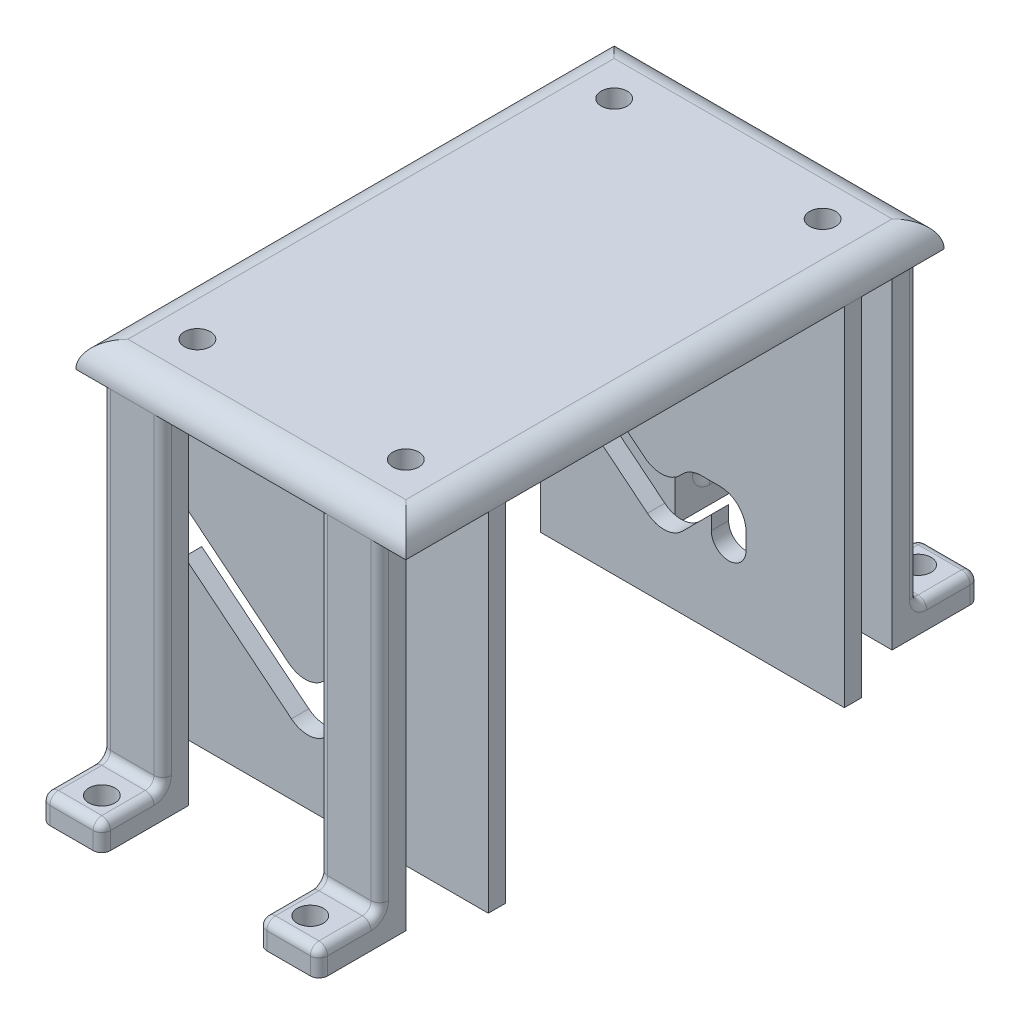
from build123d import *

# Parameters (mm, degrees)
CROQUIS1_W               = 38
CROQUIS1_H               = 62
SALIENTE_EXTRUIR1_DEPTH  = 3
CROQUIS2_R               = 1.5
CORTAR_EXTRUIR1_DEPTH    = 73.780491892
SALIENTE_EXTRUIR2_DEPTH  = 40
REDONDEO2_DEPTH          = 38
REDONDEO2_START          = -1
REDONDEO2_2_DEPTH        = 64
CROQUIS8_W               = 7
CROQUIS8_H               = 7
SALIENTE_EXTRUIR6_DEPTH  = 3
CROQUIS12_R              = 1.5
CROQUIS12_W              = 3
CROQUIS12_H              = 6
CORTAR_EXTRUIR6_DEPTH    = 40
CROQUIS14_W              = 18
CROQUIS14_H              = 20
SALIENTE_EXTRUIR7_DEPTH  = 3
CROQUIS15_W              = 18
CROQUIS15_H              = 20
SALIENTE_EXTRUIR8_DEPTH  = 3
CROQUIS17_W              = 38
CROQUIS17_H              = 2
SALIENTE_EXTRUIR9_DEPTH  = 40
CORTAR_EXTRUIR7_DEPTH    = 89.345911054
REDONDEO3_R              = 3
CROQUIS18_W              = 3
CROQUIS18_H              = 2
CORTAR_EXTRUIR8_DEPTH    = 40
CROQUIS19_W              = 18
CROQUIS19_H              = 20
CORTAR_EXTRUIR9_DEPTH    = 3
CROQUIS20_W              = 18
CROQUIS20_H              = 20
CORTAR_EXTRUIR10_DEPTH   = 3
SALIENTE_EXTRUIR10_DEPTH = 3
SALIENTE_EXTRUIR11_DEPTH = 3
REDONDEO4_R              = 1


with BuildPart() as part:
    # Croquis1 → Saliente-Extruir1 (new body)
    with BuildSketch(Plane(origin=(0, 0, 0), x_dir=(1, 0, 0), z_dir=(0, 1, 0))):
        with Locations((19, -31)):
            Rectangle(CROQUIS1_W, CROQUIS1_H)
    extrude(amount=SALIENTE_EXTRUIR1_DEPTH)

    # Croquis2 → Cortar-Extruir1 (cut, through all)
    with BuildSketch(Plane(origin=(0, 3, 0), x_dir=(1, 0, 0), z_dir=(0, 1, 0))):
        with Locations(Location((7, -7, 0), (0, 0, 270))):
            Circle(CROQUIS2_R)
        with Locations(Location((31, -7, 0), (0, 0, 270))):
            Circle(CROQUIS2_R)
        with Locations(Location((7, -55, 0), (0, 0, 270))):
            Circle(CROQUIS2_R)
        with Locations(Location((31, -55, 0), (0, 0, 270))):
            Circle(CROQUIS2_R)
    extrude(amount=-CORTAR_EXTRUIR1_DEPTH, mode=Mode.SUBTRACT)

    # Croquis3 → Saliente-Extruir2 (add)
    with BuildSketch(Plane.XZ):
        Polygon((38, 62), (38, 56), (35, 56), (35, 59), (28, 59), (28, 62), align=None)
        Polygon((0, 62), (10, 62), (10, 59), (3, 59), (3, 56), (0, 56), align=None)
        Polygon((0, 6), (0, 0), (10, 0), (10, 3), (3, 3), (3, 6), align=None)
        Polygon((28, 0), (38, 0), (38, 6), (35, 6), (35, 3), (28, 3), align=None)
    extrude(amount=SALIENTE_EXTRUIR2_DEPTH)

    # Redondeo2: read off the stored shape, not the designer's step
    # Redondeo2 outline → Redondeo2 (cut)
    with BuildSketch(Plane.YZ):
        with BuildLine():
            ThreePointArc((0, 62), (2.121320344, 61.121320344), (3, 59))
            Line((3, 59), (3, 62))
            Line((3, 62), (0, 62))
        make_face()
        with BuildLine():
            ThreePointArc((3, 3), (2.121320344, 0.878679656), (0, 0))
            Line((0, 0), (3, 0))
            Line((3, 0), (3, 3))
        make_face()
    extrude(amount=REDONDEO2_DEPTH, mode=Mode.SUBTRACT)

    # Redondeo2 2 outline → Redondeo2 2 (cut)
    with BuildSketch(Plane.XY.offset(REDONDEO2_START)):
        with BuildLine():
            Line((0, 3), (0, 0))
            ThreePointArc((0, 0), (0.878679656, 2.121320344), (3, 3))
            Line((3, 3), (0, 3))
        make_face()
        with BuildLine():
            Line((38, 3), (35, 3))
            ThreePointArc((35, 3), (37.121320344, 2.121320344), (38, 0))
            Line((38, 0), (38, 3))
        make_face()
    extrude(amount=REDONDEO2_2_DEPTH, mode=Mode.SUBTRACT)

    # Croquis8 → Saliente-Extruir6 (add)
    with BuildSketch(Plane.XZ.offset(40)):
        with Locations((6.5, 65.5)):
            Rectangle(CROQUIS8_W, CROQUIS8_H)
        with Locations((31.5, 65.5)):
            Rectangle(CROQUIS8_W, CROQUIS8_H)
        with Locations((31.5, -3.5)):
            Rectangle(CROQUIS8_W, CROQUIS8_H)
        with Locations((6.5, -3.5)):
            Rectangle(CROQUIS8_W, CROQUIS8_H)
    extrude(amount=-SALIENTE_EXTRUIR6_DEPTH)

    # Croquis12 → Cortar-Extruir6 (cut)
    with BuildSketch(Plane.XZ.offset(40)):
        with Locations(Location((7, -4, 0), (0, 0, 270))):
            Circle(CROQUIS12_R)
        with Locations(Location((31, -4, 0), (0, 0, 270))):
            Circle(CROQUIS12_R)
        with Locations(Location((31, 66, 0), (0, 0, 270))):
            Circle(CROQUIS12_R)
        with Locations(Location((7, 66, 0), (0, 0, 270))):
            Circle(CROQUIS12_R)
        with Locations((36.5, 3)):
            Rectangle(CROQUIS12_W, CROQUIS12_H)
        with Locations((36.5, 59)):
            Rectangle(CROQUIS12_W, CROQUIS12_H)
        with Locations((1.5, 59)):
            Rectangle(CROQUIS12_W, CROQUIS12_H)
        with Locations((1.5, 3)):
            Rectangle(CROQUIS12_W, CROQUIS12_H)
    extrude(amount=-CORTAR_EXTRUIR6_DEPTH, mode=Mode.SUBTRACT)

    # Croquis14 → Saliente-Extruir7 (add)
    with BuildSketch(Plane(origin=(0, 0, 59), x_dir=(-1, 0, 0), z_dir=(0, 0, -1))):
        with Locations((-19, -30)):
            Rectangle(CROQUIS14_W, CROQUIS14_H)
    extrude(amount=-SALIENTE_EXTRUIR7_DEPTH)

    # Croquis15 → Saliente-Extruir8 (add)
    with BuildSketch(Plane.XY.offset(3)):
        with Locations((19, -30)):
            Rectangle(CROQUIS15_W, CROQUIS15_H)
    extrude(amount=-SALIENTE_EXTRUIR8_DEPTH)

    # Croquis17 → Saliente-Extruir9 (add)
    with BuildSketch(Plane.XZ):
        with Locations((19, 10.5)):
            Rectangle(CROQUIS17_W, CROQUIS17_H)
        with Locations((19, 51.5)):
            Rectangle(CROQUIS17_W, CROQUIS17_H)
    extrude(amount=SALIENTE_EXTRUIR9_DEPTH)

    # Croquis16 → Cortar-Extruir7 (cut, through all)
    with BuildSketch(Plane(origin=(0, 0, 0), x_dir=(-1, 0, 0), z_dir=(0, 0, -1))):
        with BuildLine():
            Line((-17.42778873, -33.646749521), (-3, -21.929542881))
            Line((-3, -21.929542881), (-3, -16.776599839))
            Line((-3, -16.776599839), (-17.113112675, -28.238249343))
            Line((-17.113112675, -28.238249343), (-20.299570201, -25.079703159))
            Line((-20.299570201, -25.079703159), (-26.67778873, -25.079703159))
            Line((-26.67778873, -25.079703159), (-26.67778873, -30))
            ThreePointArc((-26.67778873, -30), (-24.67778873, -32), (-22.67778873, -30))
            Line((-22.67778873, -30), (-22.67778873, -28.396749521))
            Line((-22.67778873, -28.396749521), (-17.42778873, -33.646749521))
        make_face()
    extrude(amount=-CORTAR_EXTRUIR7_DEPTH, mode=Mode.SUBTRACT)

    # Redondeo3
    redondeo3_edges = [part.edges().sort_by_distance(p)[0] for p in [
        (26.67778873, -25.079703159, 60.5),
        (26.67778873, -25.079703159, 1.5),
        (26.67778873, -25.079703159, 10.5),
        (26.67778873, -25.079703159, 51.5),
        (20.299570201, -25.079703159, 60.5),
        (20.299570201, -25.079703159, 1.5),
        (20.299570201, -25.079703159, 10.5),
        (20.299570201, -25.079703159, 51.5),
        (17.113112675, -28.238249343, 60.5),
        (17.113112675, -28.238249343, 1.5),
        (17.113112675, -28.238249343, 10.5),
        (17.113112675, -28.238249343, 51.5),
        (17.42778873, -33.646749521, 60.5),
        (17.42778873, -33.646749521, 1.5),
        (17.42778873, -33.646749521, 10.5),
        (17.42778873, -33.646749521, 51.5),
    ]]
    fillet(redondeo3_edges, radius=REDONDEO3_R)

    # Croquis18 → Cortar-Extruir8 (cut)
    with BuildSketch(Plane.XZ.offset(40)):
        with Locations((1.5, 51.5)):
            Rectangle(CROQUIS18_W, CROQUIS18_H)
        with Locations((1.5, 10.5)):
            Rectangle(CROQUIS18_W, CROQUIS18_H)
    extrude(amount=-CORTAR_EXTRUIR8_DEPTH, mode=Mode.SUBTRACT)

    # Croquis19 → Cortar-Extruir9 (cut)
    with BuildSketch(Plane(origin=(0, 0, 0), x_dir=(-1, 0, 0), z_dir=(0, 0, -1))):
        with Locations((-19, -30)):
            Rectangle(CROQUIS19_W, CROQUIS19_H)
    extrude(amount=-CORTAR_EXTRUIR9_DEPTH, mode=Mode.SUBTRACT)


with BuildPart() as cortar_extruir9_piece_1:
    # of the separate pieces the step leaves, piece 1, a body of its own (cortar_extruir9_pieces)
    add(part.part.solids().sort_by_distance((3, -16.776599839, 0))[0])

    # Croquis20 → Cortar-Extruir10 (cut)
    with BuildSketch(Plane.XY.offset(62)):
        with Locations((19, -30)):
            Rectangle(CROQUIS20_W, CROQUIS20_H)
    extrude(amount=-CORTAR_EXTRUIR10_DEPTH, mode=Mode.SUBTRACT)


with BuildPart() as cortar_extruir9_piece_2:
    # of the separate pieces the step leaves, piece 2, a body of its own (cortar_extruir9_pieces)
    add(part.part.solids().sort_by_distance((10, -27.614436666, 0))[0])



with BuildPart() as cortar_extruir10_piece_1:
    # of the separate pieces the step leaves, piece 1, a body of its own (cortar_extruir10_pieces)
    add(cortar_extruir9_piece_1.part.solids().sort_by_distance((3, -16.776599839, 0))[0])



with BuildPart() as cortar_extruir10_piece_2:
    # of the separate pieces the step leaves, piece 2, a body of its own (cortar_extruir10_pieces)
    add(cortar_extruir9_piece_1.part.solids().sort_by_distance((10, -27.614436666, 59))[0])


with BuildPart() as cortar_extruir10_piece_1_1:
    add(cortar_extruir10_piece_1.part)

    add(cortar_extruir10_piece_2.part)  # Saliente-Extruir10 merges Cortar-Extruir10 piece 2
    # Croquis21 → Saliente-Extruir10 (add)
    with BuildSketch(Plane.XY.offset(62)):
        Polygon((3, -16.776599839), (3, -21.929542881), (10, -27.614436666), (10, -22.461493624), align=None)
    extrude(amount=-SALIENTE_EXTRUIR10_DEPTH)


with BuildPart() as cortar_extruir9_piece_2_1:
    add(cortar_extruir9_piece_2.part)

    add(cortar_extruir10_piece_1_1.part)  # Saliente-Extruir11 merges Cortar-Extruir10 piece 1
    # Croquis22 → Saliente-Extruir11 (add)
    with BuildSketch(Plane(origin=(0, 0, 0), x_dir=(-1, 0, 0), z_dir=(0, 0, -1))):
        Polygon((-10, -22.461493624), (-3, -16.776599839), (-3, -21.929542881), (-10, -27.614436666), align=None)
    extrude(amount=-SALIENTE_EXTRUIR11_DEPTH)

    # Redondeo4
    # the kernel refuses this fillet: 1 mm, written as the material it adds along each edge
    with BuildSketch(Plane(origin=(10, -37, 0), x_dir=(0, 1, 0), z_dir=(-1, 0, 0)), Plane(origin=(28, -37, 62), x_dir=(0, 1, 0), z_dir=(1, 0, 0))) as redondeo4_piece_1:
        with BuildLine():
            CenterArc((REDONDEO4_R, REDONDEO4_R), REDONDEO4_R, 180, 90)
            Line((0, REDONDEO4_R), (0, 0))
            Line((0, 0), (REDONDEO4_R, 0))
        make_face()
    extrude(amount=7)
    with BuildSketch(Plane(origin=(28, -37, 0), x_dir=(0, 1, 0), z_dir=(1, 0, 0)), Plane(origin=(10, -37, 62), x_dir=(0, 1, 0), z_dir=(-1, 0, 0))) as redondeo4_piece_2:
        with BuildLine():
            CenterArc((REDONDEO4_R, -REDONDEO4_R), REDONDEO4_R, 90, 90)
            Line((0, -REDONDEO4_R), (0, 0))
            Line((0, 0), (REDONDEO4_R, 0))
        make_face()
    extrude(amount=7)
    # the kernel refuses this fillet: 1 mm, written as the material it takes off along each edge
    with BuildSketch(Plane(origin=(0.5, -37, -7), x_dir=(0, -1, 0), z_dir=(1, 0, 0)), Plane(origin=(37.5, -37, 69), x_dir=(0, -1, 0), z_dir=(-1, 0, 0))) as redondeo4_2_piece_1:
        with BuildLine():
            CenterArc((REDONDEO4_R, -REDONDEO4_R), REDONDEO4_R, 90, 90)
            Line((0, -REDONDEO4_R), (0, 0))
            Line((0, 0), (REDONDEO4_R, 0))
        make_face()
    extrude(amount=12, mode=Mode.SUBTRACT)
    with BuildSketch(Plane(origin=(10, -42.5, -7), x_dir=(0, 0, 1), z_dir=(0, 1, 0)), Plane(origin=(28, -42.5, 69), x_dir=(0, 0, -1), z_dir=(0, 1, 0)), Plane(origin=(35, -42.5, -7), x_dir=(0, 0, 1), z_dir=(0, 1, 0)), Plane(origin=(3, -42.5, 69), x_dir=(0, 0, -1), z_dir=(0, 1, 0))) as redondeo4_2_piece_2:
        with BuildLine():
            CenterArc((REDONDEO4_R, -REDONDEO4_R), REDONDEO4_R, 90, 90)
            Line((0, -REDONDEO4_R), (0, 0))
            Line((0, 0), (REDONDEO4_R, 0))
        make_face()
    extrude(amount=8, mode=Mode.SUBTRACT)
    with BuildSketch(Plane(origin=(3, -42.5, -7), x_dir=(0, 0, 1), z_dir=(0, 1, 0)), Plane(origin=(28, -42.5, -7), x_dir=(0, 0, 1), z_dir=(0, 1, 0)), Plane(origin=(10, -42.5, 69), x_dir=(0, 0, -1), z_dir=(0, 1, 0)), Plane(origin=(35, -42.5, 69), x_dir=(0, 0, -1), z_dir=(0, 1, 0))) as redondeo4_2_piece_3:
        with BuildLine():
            CenterArc((REDONDEO4_R, REDONDEO4_R), REDONDEO4_R, 180, 90)
            Line((0, REDONDEO4_R), (0, 0))
            Line((0, 0), (REDONDEO4_R, 0))
        make_face()
    extrude(amount=8, mode=Mode.SUBTRACT)
    with BuildSketch(Plane(origin=(37.5, -37, -7), x_dir=(0, -1, 0), z_dir=(-1, 0, 0)), Plane(origin=(0.5, -37, 69), x_dir=(0, -1, 0), z_dir=(1, 0, 0))) as redondeo4_2_piece_4:
        with BuildLine():
            CenterArc((REDONDEO4_R, REDONDEO4_R), REDONDEO4_R, 180, 90)
            Line((0, REDONDEO4_R), (0, 0))
            Line((0, 0), (REDONDEO4_R, 0))
        make_face()
    extrude(amount=12, mode=Mode.SUBTRACT)
    # the kernel refuses this fillet: 1 mm, written as the material it takes off along each edge
    with BuildSketch(Plane(origin=(34, -38, -6), x_dir=(0, 1, 0), z_dir=(1, 0, 0))) as redondeo4_3_piece_1_section:
        Polygon((0, 0), (REDONDEO4_R, 0), (REDONDEO4_R, -REDONDEO4_R), (0, -REDONDEO4_R), align=None)
    redondeo4_3_piece_1 = extrude(amount=REDONDEO4_R, mode=Mode.PRIVATE)
    redondeo4_3_piece_1 = redondeo4_3_piece_1 - Plane(origin=(34, -38, -6), x_dir=(0, -0.7071067811865475, 0.7071067811865475), z_dir=(1, 0, 0)) * Sphere(REDONDEO4_R, mode=Mode.PRIVATE)
    add(redondeo4_3_piece_1, mode=Mode.SUBTRACT)
    with BuildSketch(Plane(origin=(34, -38, 68), x_dir=(0, 1, 0), z_dir=(1, 0, 0))) as redondeo4_3_piece_2_section:
        Polygon((0, 0), (REDONDEO4_R, 0), (REDONDEO4_R, REDONDEO4_R), (0, REDONDEO4_R), align=None)
    redondeo4_3_piece_2 = extrude(amount=REDONDEO4_R, mode=Mode.PRIVATE)
    redondeo4_3_piece_2 = redondeo4_3_piece_2 - Plane(origin=(34, -38, 68), x_dir=(0, -0.7071067811865475, -0.7071067811865475), z_dir=(1, 0, 0)) * Sphere(REDONDEO4_R, mode=Mode.PRIVATE)
    add(redondeo4_3_piece_2, mode=Mode.SUBTRACT)
    with BuildSketch(Plane(origin=(9, -38, 68), x_dir=(0, 1, 0), z_dir=(1, 0, 0))) as redondeo4_3_piece_3_section:
        Polygon((0, 0), (REDONDEO4_R, 0), (REDONDEO4_R, REDONDEO4_R), (0, REDONDEO4_R), align=None)
    redondeo4_3_piece_3 = extrude(amount=REDONDEO4_R, mode=Mode.PRIVATE)
    redondeo4_3_piece_3 = redondeo4_3_piece_3 - Plane(origin=(9, -38, 68), x_dir=(0, -0.7071067811865475, -0.7071067811865475), z_dir=(1, 0, 0)) * Sphere(REDONDEO4_R, mode=Mode.PRIVATE)
    add(redondeo4_3_piece_3, mode=Mode.SUBTRACT)
    with BuildSketch(Plane(origin=(29, -38, 68), x_dir=(0, 1, 0), z_dir=(-1, 0, 0))) as redondeo4_3_piece_4_section:
        Polygon((0, 0), (REDONDEO4_R, 0), (REDONDEO4_R, -REDONDEO4_R), (0, -REDONDEO4_R), align=None)
    redondeo4_3_piece_4 = extrude(amount=REDONDEO4_R, mode=Mode.PRIVATE)
    redondeo4_3_piece_4 = redondeo4_3_piece_4 - Plane(origin=(29, -38, 68), x_dir=(0, -0.7071067811865475, -0.7071067811865475), z_dir=(-1, 0, 0)) * Sphere(REDONDEO4_R, mode=Mode.PRIVATE)
    add(redondeo4_3_piece_4, mode=Mode.SUBTRACT)
    with BuildSketch(Plane(origin=(29, -38, -6), x_dir=(0, 1, 0), z_dir=(-1, 0, 0))) as redondeo4_3_piece_5_section:
        Polygon((0, 0), (REDONDEO4_R, 0), (REDONDEO4_R, REDONDEO4_R), (0, REDONDEO4_R), align=None)
    redondeo4_3_piece_5 = extrude(amount=REDONDEO4_R, mode=Mode.PRIVATE)
    redondeo4_3_piece_5 = redondeo4_3_piece_5 - Plane(origin=(29, -38, -6), x_dir=(0, -0.7071067811865475, 0.7071067811865475), z_dir=(-1, 0, 0)) * Sphere(REDONDEO4_R, mode=Mode.PRIVATE)
    add(redondeo4_3_piece_5, mode=Mode.SUBTRACT)
    with BuildSketch(Plane(origin=(4, -38, 68), x_dir=(0, 1, 0), z_dir=(-1, 0, 0))) as redondeo4_3_piece_6_section:
        Polygon((0, 0), (REDONDEO4_R, 0), (REDONDEO4_R, -REDONDEO4_R), (0, -REDONDEO4_R), align=None)
    redondeo4_3_piece_6 = extrude(amount=REDONDEO4_R, mode=Mode.PRIVATE)
    redondeo4_3_piece_6 = redondeo4_3_piece_6 - Plane(origin=(4, -38, 68), x_dir=(0, -0.7071067811865475, -0.7071067811865475), z_dir=(-1, 0, 0)) * Sphere(REDONDEO4_R, mode=Mode.PRIVATE)
    add(redondeo4_3_piece_6, mode=Mode.SUBTRACT)
    with BuildSketch(Plane(origin=(4, -38, -6), x_dir=(0, 1, 0), z_dir=(-1, 0, 0))) as redondeo4_3_piece_7_section:
        Polygon((0, 0), (REDONDEO4_R, 0), (REDONDEO4_R, REDONDEO4_R), (0, REDONDEO4_R), align=None)
    redondeo4_3_piece_7 = extrude(amount=REDONDEO4_R, mode=Mode.PRIVATE)
    redondeo4_3_piece_7 = redondeo4_3_piece_7 - Plane(origin=(4, -38, -6), x_dir=(0, -0.7071067811865475, 0.7071067811865475), z_dir=(-1, 0, 0)) * Sphere(REDONDEO4_R, mode=Mode.PRIVATE)
    add(redondeo4_3_piece_7, mode=Mode.SUBTRACT)
    with BuildSketch(Plane(origin=(9, -38, -6), x_dir=(0, 1, 0), z_dir=(1, 0, 0))) as redondeo4_3_piece_8_section:
        Polygon((0, 0), (REDONDEO4_R, 0), (REDONDEO4_R, -REDONDEO4_R), (0, -REDONDEO4_R), align=None)
    redondeo4_3_piece_8 = extrude(amount=REDONDEO4_R, mode=Mode.PRIVATE)
    redondeo4_3_piece_8 = redondeo4_3_piece_8 - Plane(origin=(9, -38, -6), x_dir=(0, -0.7071067811865475, 0.7071067811865475), z_dir=(1, 0, 0)) * Sphere(REDONDEO4_R, mode=Mode.PRIVATE)
    add(redondeo4_3_piece_8, mode=Mode.SUBTRACT)
    with BuildSketch(Plane(origin=(10, -37, -6), x_dir=(0, -1, 0), z_dir=(0, 0, 1)), Plane(origin=(3, -37, -1), x_dir=(0, -1, 0), z_dir=(0, 0, -1)), Plane(origin=(28, -37, 68), x_dir=(0, -1, 0), z_dir=(0, 0, -1)), Plane(origin=(35, -37, 63), x_dir=(0, -1, 0), z_dir=(0, 0, 1))) as redondeo4_3_piece_9:
        with BuildLine():
            CenterArc((REDONDEO4_R, -REDONDEO4_R), REDONDEO4_R, 90, 90)
            Line((0, -REDONDEO4_R), (0, 0))
            Line((0, 0), (REDONDEO4_R, 0))
        make_face()
    extrude(amount=5, mode=Mode.SUBTRACT)
    with BuildSketch(Plane(origin=(3, 0, 0), x_dir=(0, 0, 1), z_dir=(0, -1, 0)), Plane(origin=(10, -36, 0), x_dir=(0, 0, 1), z_dir=(0, 1, 0)), Plane(origin=(35, -36, 0), x_dir=(0, 0, 1), z_dir=(0, 1, 0)), Plane(origin=(28, -36, 62), x_dir=(0, 0, -1), z_dir=(0, 1, 0)), Plane(origin=(3, -36, 62), x_dir=(0, 0, -1), z_dir=(0, 1, 0)), Plane(origin=(10, 0, 62), x_dir=(0, 0, -1), z_dir=(0, -1, 0))) as redondeo4_3_piece_10:
        with BuildLine():
            CenterArc((REDONDEO4_R, -REDONDEO4_R), REDONDEO4_R, 90, 90)
            Line((0, -REDONDEO4_R), (0, 0))
            Line((0, 0), (REDONDEO4_R, 0))
        make_face()
    extrude(amount=36, mode=Mode.SUBTRACT)
    with BuildSketch(Plane(origin=(28, -36, 0), x_dir=(0, 0, 1), z_dir=(0, 1, 0)), Plane(origin=(35, -36, 62), x_dir=(0, 0, -1), z_dir=(0, 1, 0))) as redondeo4_3_piece_11:
        with BuildLine():
            CenterArc((REDONDEO4_R, REDONDEO4_R), REDONDEO4_R, 180, 90)
            Line((0, REDONDEO4_R), (0, 0))
            Line((0, 0), (REDONDEO4_R, 0))
        make_face()
    extrude(amount=36, mode=Mode.SUBTRACT)
    with BuildSketch(Plane(origin=(3, -37, 63), x_dir=(0, -1, 0), z_dir=(0, 0, 1)), Plane(origin=(28, -37, -6), x_dir=(0, -1, 0), z_dir=(0, 0, 1)), Plane(origin=(10, -37, 68), x_dir=(0, -1, 0), z_dir=(0, 0, -1)), Plane(origin=(35, -37, -1), x_dir=(0, -1, 0), z_dir=(0, 0, -1))) as redondeo4_3_piece_12:
        with BuildLine():
            CenterArc((REDONDEO4_R, REDONDEO4_R), REDONDEO4_R, 180, 90)
            Line((0, REDONDEO4_R), (0, 0))
            Line((0, 0), (REDONDEO4_R, 0))
        make_face()
    extrude(amount=5, mode=Mode.SUBTRACT)
    with BuildSketch(Plane(origin=(35, -36, -1), x_dir=(0, 0, 1), z_dir=(0, 1, 0))) as redondeo4_3_piece_13:
        with BuildLine():
            CenterArc((1 + REDONDEO4_R, -REDONDEO4_R), REDONDEO4_R, 90, 90)
            Line((1, -REDONDEO4_R), (1, 0))
            Line((1, 0), (1 + REDONDEO4_R, 0))
        make_face()
    revolve(axis=Axis((35, -36, -1), (1, 0, 0)), revolution_arc=90, mode=Mode.SUBTRACT)
    with BuildSketch(Plane(origin=(35, -36, 63), x_dir=(0, 0, -1), z_dir=(0, 1, 0))) as redondeo4_3_piece_14:
        with BuildLine():
            CenterArc((1 + REDONDEO4_R, REDONDEO4_R), REDONDEO4_R, 180, 90)
            Line((1, REDONDEO4_R), (1, 0))
            Line((1, 0), (1 + REDONDEO4_R, 0))
        make_face()
    revolve(axis=Axis((35, -36, 63), (-1, 0, 0)), revolution_arc=90, mode=Mode.SUBTRACT)
    with BuildSketch(Plane(origin=(10, -36, 63), x_dir=(0, 0, -1), z_dir=(0, 1, 0))) as redondeo4_3_piece_15:
        with BuildLine():
            CenterArc((1 + REDONDEO4_R, REDONDEO4_R), REDONDEO4_R, 180, 90)
            Line((1, REDONDEO4_R), (1, 0))
            Line((1, 0), (1 + REDONDEO4_R, 0))
        make_face()
    revolve(axis=Axis((10, -36, 63), (-1, 0, 0)), revolution_arc=90, mode=Mode.SUBTRACT)
    with BuildSketch(Plane(origin=(3, -36, 63), x_dir=(0, 0, -1), z_dir=(0, 1, 0))) as redondeo4_3_piece_16:
        with BuildLine():
            CenterArc((1 + REDONDEO4_R, -REDONDEO4_R), REDONDEO4_R, 90, 90)
            Line((1, -REDONDEO4_R), (1, 0))
            Line((1, 0), (1 + REDONDEO4_R, 0))
        make_face()
    revolve(axis=Axis((3, -36, 63), (-1, 0, 0)), revolution_arc=90, mode=Mode.SUBTRACT)
    with BuildSketch(Plane(origin=(28, -36, 63), x_dir=(0, 0, -1), z_dir=(0, 1, 0))) as redondeo4_3_piece_17:
        with BuildLine():
            CenterArc((1 + REDONDEO4_R, -REDONDEO4_R), REDONDEO4_R, 90, 90)
            Line((1, -REDONDEO4_R), (1, 0))
            Line((1, 0), (1 + REDONDEO4_R, 0))
        make_face()
    revolve(axis=Axis((28, -36, 63), (-1, 0, 0)), revolution_arc=90, mode=Mode.SUBTRACT)
    with BuildSketch(Plane(origin=(28, -36, -1), x_dir=(0, 0, 1), z_dir=(0, 1, 0))) as redondeo4_3_piece_18:
        with BuildLine():
            CenterArc((1 + REDONDEO4_R, REDONDEO4_R), REDONDEO4_R, 180, 90)
            Line((1, REDONDEO4_R), (1, 0))
            Line((1, 0), (1 + REDONDEO4_R, 0))
        make_face()
    revolve(axis=Axis((28, -36, -1), (1, 0, 0)), revolution_arc=90, mode=Mode.SUBTRACT)
    with BuildSketch(Plane(origin=(10, -36, -1), x_dir=(0, 0, 1), z_dir=(0, 1, 0))) as redondeo4_3_piece_19:
        with BuildLine():
            CenterArc((1 + REDONDEO4_R, -REDONDEO4_R), REDONDEO4_R, 90, 90)
            Line((1, -REDONDEO4_R), (1, 0))
            Line((1, 0), (1 + REDONDEO4_R, 0))
        make_face()
    revolve(axis=Axis((10, -36, -1), (1, 0, 0)), revolution_arc=90, mode=Mode.SUBTRACT)
    with BuildSketch(Plane(origin=(3, -36, -1), x_dir=(0, 0, 1), z_dir=(0, 1, 0))) as redondeo4_3_piece_20:
        with BuildLine():
            CenterArc((1 + REDONDEO4_R, REDONDEO4_R), REDONDEO4_R, 180, 90)
            Line((1, REDONDEO4_R), (1, 0))
            Line((1, 0), (1 + REDONDEO4_R, 0))
        make_face()
    revolve(axis=Axis((3, -36, -1), (1, 0, 0)), revolution_arc=90, mode=Mode.SUBTRACT)


solid = cortar_extruir9_piece_2_1.part
